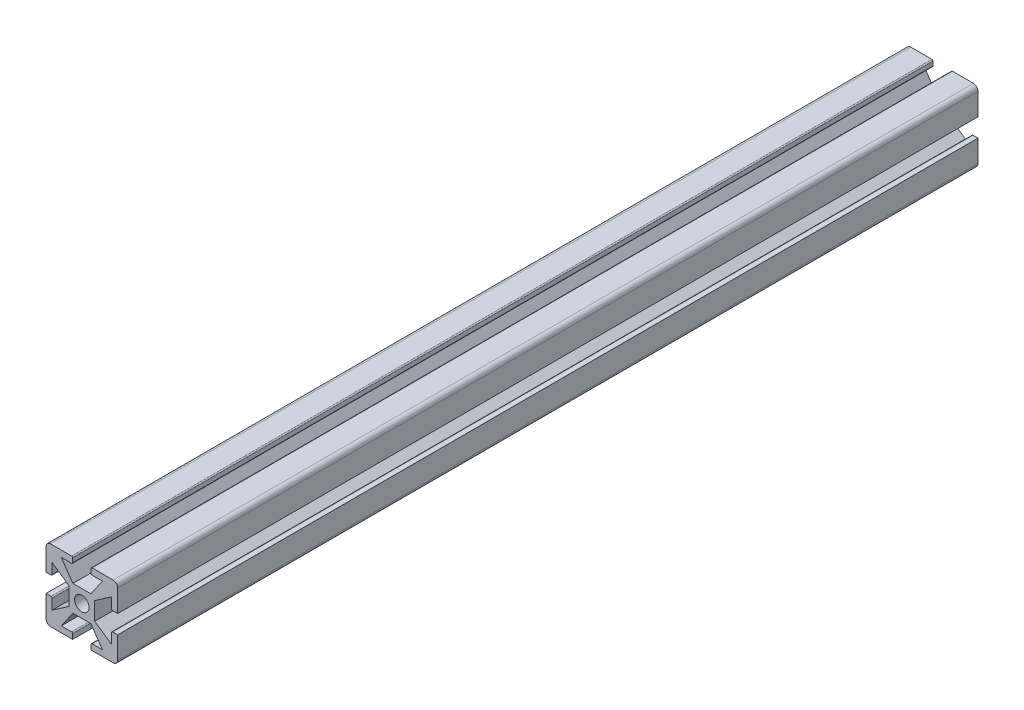
from build123d import *

# Parameters (mm, degrees)
SKETCH1_W           = 25.4
SKETCH1_H           = 25.4
BOSS_EXTRUDE1_DEPTH = 304.8
FILLET1_R           = 1.5875
HOLE1_OUTLINE_R     = 2.5527
HOLE1_DEPTH         = 304.8
SKETCH7_W           = 6.5278
SKETCH7_H           = 2.2352
CUT_EXTRUDE2_DEPTH  = 304.8
FILLET4_R           = 0.396875
CIRPATTERN2_DEPTH   = 304.8


# Read off the part's stored shape, not the designer's step: Hole1, CirPattern2
with BuildPart() as part:
    # Sketch1 → Boss-Extrude1 (new body)
    with BuildSketch(Plane.XY):
        Rectangle(SKETCH1_W, SKETCH1_H)
    extrude(amount=BOSS_EXTRUDE1_DEPTH)

    # Fillet1
    fillet1_edges = [part.edges().sort_by_distance(p)[0] for p in [
        (12.7, -12.7, 152.4),
        (-12.7, -12.7, 152.4),
        (-12.7, 12.7, 152.4),
        (12.7, 12.7, 152.4),
    ]]
    fillet(fillet1_edges, radius=FILLET1_R)

    # Hole1 outline → Hole1 (cut)
    with BuildSketch(Plane.XY):
        with Locations((0, -0.048792482)):
            Circle(HOLE1_OUTLINE_R)
    extrude(amount=HOLE1_DEPTH, mode=Mode.SUBTRACT)

    # Sketch7 → Cut-Extrude2 (cut)
    with BuildSketch(Plane.XY.offset(304.8)):
        with Locations((0, 11.5824)):
            Rectangle(SKETCH7_W, SKETCH7_H)
        Polygon((-3.175, 4.5212), (-7.3025, 10.4648), (7.3025, 10.4648), (3.175, 4.5212), align=None)
    extrude(amount=-CUT_EXTRUDE2_DEPTH, mode=Mode.SUBTRACT)

    # Fillet4
    fillet4_edges = [part.edges().sort_by_distance(p)[0] for p in [
        (-3.2639, 10.4648, 152.4),
        (-3.2639, 12.7, 152.4),
        (3.2639, 12.7, 152.4),
        (3.2639, 10.4648, 152.4),
    ]]
    fillet(fillet4_edges, radius=FILLET4_R)

    # CirPattern2 outline → CirPattern2 (cut)
    with BuildSketch(Plane.XY):
        with BuildLine():
            ThreePointArc((-3.660775, -10.562384964), (-3.380141996, -10.67862696), (-3.2639, -10.959259964))
            Line((-3.2639, -10.959259964), (-3.2639, -12.7))
            Line((-3.2639, -12.7), (3.2639, -12.7))
            Line((3.2639, -12.7), (3.2639, -10.959259964))
            ThreePointArc((3.2639, -10.959259964), (3.380141996, -10.67862696), (3.660775, -10.562384964))
            Line((3.660775, -10.562384964), (7.3025, -10.562384964))
            Line((7.3025, -10.562384964), (3.175, -4.618784964))
            Line((3.175, -4.618784964), (-3.175, -4.618784964))
            Line((-3.175, -4.618784964), (-7.3025, -10.562384964))
            Line((-7.3025, -10.562384964), (-3.660775, -10.562384964))
        make_face()
        with BuildLine():
            Line((-12.7, -3.312692482), (-10.910467482, -3.312692482))
            ThreePointArc((-10.910467482, -3.312692482), (-10.629834478, -3.428934478), (-10.513592482, -3.709567482))
            Line((-10.513592482, -3.709567482), (-10.513592482, -7.351292482))
            Line((-10.513592482, -7.351292482), (-4.569992482, -3.223792482))
            Line((-4.569992482, -3.223792482), (-4.569992482, 3.126207518))
            Line((-4.569992482, 3.126207518), (-10.513592482, 7.253707518))
            Line((-10.513592482, 7.253707518), (-10.513592482, 3.611982518))
            ThreePointArc((-10.513592482, 3.611982518), (-10.629834478, 3.331349514), (-10.910467482, 3.215107518))
            Line((-10.910467482, 3.215107518), (-12.7, 3.215107518))
            Line((-12.7, 3.215107518), (-12.7, -3.312692482))
        make_face()
        with BuildLine():
            ThreePointArc((10.513592482, -3.709567482), (10.629834478, -3.428934478), (10.910467482, -3.312692482))
            Line((10.910467482, -3.312692482), (12.7, -3.312692482))
            Line((12.7, -3.312692482), (12.7, 3.215107518))
            Line((12.7, 3.215107518), (10.910467482, 3.215107518))
            ThreePointArc((10.910467482, 3.215107518), (10.629834478, 3.331349514), (10.513592482, 3.611982518))
            Line((10.513592482, 3.611982518), (10.513592482, 7.253707518))
            Line((10.513592482, 7.253707518), (4.569992482, 3.126207518))
            Line((4.569992482, 3.126207518), (4.569992482, -3.223792482))
            Line((4.569992482, -3.223792482), (10.513592482, -7.351292482))
            Line((10.513592482, -7.351292482), (10.513592482, -3.709567482))
        make_face()
    extrude(amount=CIRPATTERN2_DEPTH, mode=Mode.SUBTRACT)


solid = part.part
